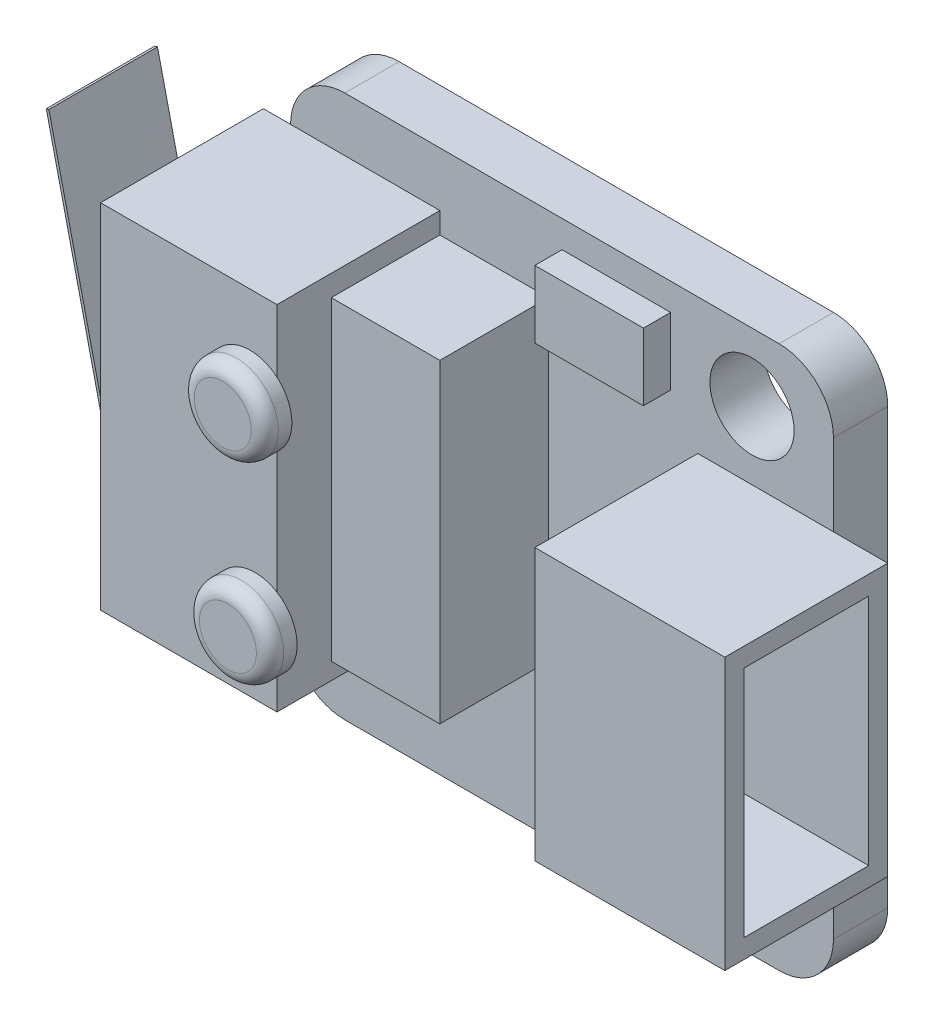
from build123d import *

# Parameters (mm, degrees)
SKETCH1_W                  = 20
SKETCH1_H                  = 20
BOSS_EXTRUDE1_DEPTH        = 2
SKETCH2_W                  = 7
SKETCH2_H                  = 10
BOSS_EXTRUDE2_DEPTH        = 6
SKETCH3_W                  = 6.5
SKETCH3_H                  = 13
BOSS_EXTRUDE3_DEPTH        = 6
BOSS_EXTRUDE4_REACH        = 29.324
SKETCH4_W                  = 0.1
SKETCH4_H                  = 4
SKETCH5_W                  = 4
SKETCH5_H                  = 2.479052782
BOSS_EXTRUDE5_DEPTH        = 1
SKETCH6_W                  = 3
SKETCH6_H                  = 12.5
BOSS_EXTRUDE6_DEPTH        = 2
SKETCH7_W                  = 2
SKETCH7_H                  = 7
BOSS_EXTRUDE7_DEPTH        = 2
SKETCH8_W                  = 4.6
SKETCH8_H                  = 8.6
CUT_EXTRUDE1_DEPTH         = 6.3
SKETCH9_W                  = 1
SKETCH9_H                  = 1
SKETCH10_W                 = 1
SKETCH10_H                 = 1
SKETCH11_W                 = 1.55
SKETCH11_H                 = 1
SKETCH12_W                 = 1.55
SKETCH12_H                 = 1
F_3_1_3_1_DIAMETER_HOLE1_D = 3.1
RIB1_START                 = -5.8
RIB1_OUTLINE_W             = 4
RIB1_OUTLINE_H             = 4
RIB1_DEPTH                 = 11.6
FILLET1_R                  = 0.5
FILLET2_R                  = 2


# Read off the part's stored shape, not the designer's step: Rib1
with BuildPart() as part:
    # Sketch1 → Boss-Extrude1 (new body)
    with BuildSketch(Plane.XY.offset(2)):
        Rectangle(SKETCH1_W, SKETCH1_H)
    extrude(amount=-BOSS_EXTRUDE1_DEPTH)

    # Sketch2 → Boss-Extrude2 (add)
    with BuildSketch(Plane.XY.offset(2)):
        with Locations((8.5, 0)):
            Rectangle(SKETCH2_W, SKETCH2_H)
    extrude(amount=BOSS_EXTRUDE2_DEPTH)

    # Sketch3 → Boss-Extrude3 (add)
    with BuildSketch(Plane.XY.offset(2)):
        with Locations((-7.75, 1.5)):
            Rectangle(SKETCH3_W, SKETCH3_H)
    extrude(amount=BOSS_EXTRUDE3_DEPTH)

    # Boss-Extrude4: up to this plane
    boss_extrude4_end = Plane(origin=(-11, -5, 8), z_dir=(1, 0, 0))
    # Sketch4 → Boss-Extrude4 (add, up to the surface)
    with BuildSketch(Plane(origin=(-2.679775281, 11.612359551, 0), x_dir=(-0.9743911956946198, -0.22485950669875843, 0), z_dir=(-0.22485950669875843, 0.9743911956946198, 0)), mode=Mode.PRIVATE) as boss_extrude4_sk1:
        with Locations((11.567741179, 5)):
            Rectangle(SKETCH4_W, SKETCH4_H)
    boss_extrude4_tool1 = split(extrude(boss_extrude4_sk1.sketch, amount=-BOSS_EXTRUDE4_REACH, mode=Mode.PRIVATE), bisect_by=boss_extrude4_end, keep=Keep.BOTH, mode=Mode.PRIVATE)
    add(boss_extrude4_tool1.solids().sort_by_distance((-13.95128, 9.011243, 5))[0])

    # Sketch5 → Boss-Extrude5 (add)
    with BuildSketch(Plane.XY.offset(2)):
        with Locations((2, 7.760473609)):
            Rectangle(SKETCH5_W, SKETCH5_H)
    extrude(amount=BOSS_EXTRUDE5_DEPTH)

    # Sketch6 → Boss-Extrude6 (add)
    with BuildSketch(Plane(origin=(0, 0, 0), x_dir=(-1, 0, 0), z_dir=(0, 0, -1))):
        with Locations((2.5, 1.25)):
            Rectangle(SKETCH6_W, SKETCH6_H)
    extrude(amount=BOSS_EXTRUDE6_DEPTH)

    # Sketch7 → Boss-Extrude7 (add)
    with BuildSketch(Plane(origin=(0, 0, 0), x_dir=(-1, 0, 0), z_dir=(0, 0, -1))):
        with Locations((-5, 0)):
            Rectangle(SKETCH7_W, SKETCH7_H)
    extrude(amount=BOSS_EXTRUDE7_DEPTH)

    # Sketch8 → Cut-Extrude1 (cut)
    with BuildSketch(Plane(origin=(12, 0, 0), x_dir=(0, 0, -1), z_dir=(1, 0, 0))):
        with Locations((-5, 0)):
            Rectangle(SKETCH8_W, SKETCH8_H)
    extrude(amount=-CUT_EXTRUDE1_DEPTH, mode=Mode.SUBTRACT)

    # Sketch9 → Revolve1 (revolve)
    with BuildSketch(Plane(origin=(0, -1.5, 0), x_dir=(1, 0, 0), z_dir=(0, 1, 0))):
        with Locations((-5.5, 0.5)):
            Rectangle(SKETCH9_W, SKETCH9_H)
    revolve(axis=Axis((-6, -1.5, -1), (0, 0, 1)))

    # Sketch10 → Revolve2 (revolve)
    with BuildSketch(Plane(origin=(0, 5, 0), x_dir=(1, 0, 0), z_dir=(0, 1, 0))):
        with Locations((-5.5, 0.5)):
            Rectangle(SKETCH10_W, SKETCH10_H)
    revolve(axis=Axis((-6, 5, -1), (0, 0, 1)))

    # Sketch11 → Revolve3 (revolve)
    with BuildSketch(Plane.XZ.offset(-4.5), mode=Mode.PRIVATE) as revolve3_sk:
        with Locations((-4.725, 8.5)):
            Rectangle(SKETCH11_W, SKETCH11_H)
    revolve(revolve3_sk.sketch.rotate(Axis((-5.5, 4.5, 9), (0, 0, -1)), 180), axis=Axis((-5.5, 4.5, 9), (0, 0, -1)))

    # Sketch12 → Revolve4 (revolve)
    with BuildSketch(Plane.XZ.offset(2.5), mode=Mode.PRIVATE) as revolve4_sk:
        with Locations((-4.533061125, 8.5)):
            Rectangle(SKETCH12_W, SKETCH12_H)
    revolve(revolve4_sk.sketch.rotate(Axis((-5.308061125, -2.5, 9), (0, 0, -1)), 180), axis=Axis((-5.308061125, -2.5, 9), (0, 0, -1)))

    # Ø3.1 (3.1) Diameter Hole1 (through all)
    with Locations(Plane.XY.offset(2)):
        with Locations((7, -7.5), (7, 7.5)):
            Hole(F_3_1_3_1_DIAMETER_HOLE1_D / 2)

    # Rib1 outline → Rib1 (add)
    with BuildSketch(Plane(origin=(0, 1.420947218, 0), x_dir=(1, 0, 0), z_dir=(0, 1, 0)).offset(RIB1_START)):
        with Locations((-2.5, -4)):
            Rectangle(RIB1_OUTLINE_W, RIB1_OUTLINE_H)
    extrude(amount=RIB1_DEPTH)

    # Fillet1
    fillet1_edges = [part.edges().sort_by_distance(p)[0] for p in [
        (-3.95, 4.5, 9),
        (-3.758061125, -2.5, 9),
    ]]
    fillet(fillet1_edges, radius=FILLET1_R)

    # Fillet2
    fillet2_edges = [part.edges().sort_by_distance(p)[0] for p in [
        (10, 10, 1),
        (10, -10, 1),
        (-10, -10, 1),
        (-10, 10, 1),
    ]]
    fillet(fillet2_edges, radius=FILLET2_R)


solid = part.part
